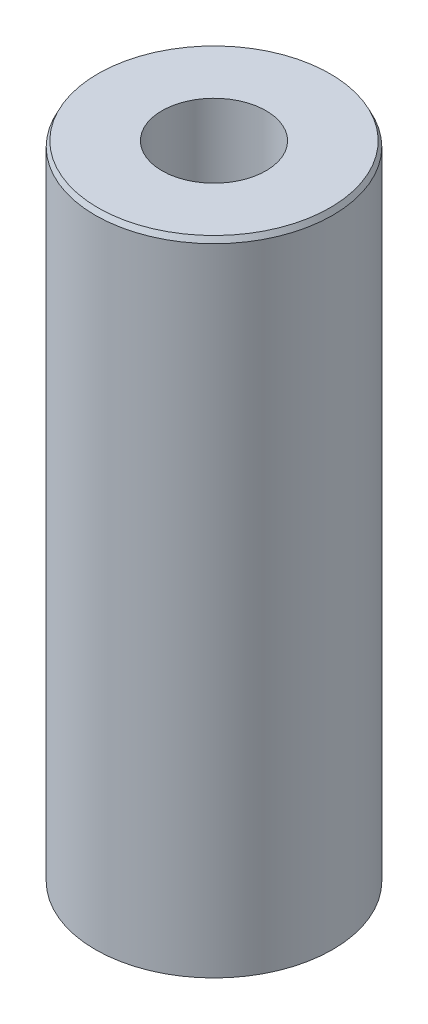
from build123d import *
from OCP.BRepFilletAPI import BRepFilletAPI_MakeChamfer

# Parameters (mm, degrees)
SKETCH1_R           = 52.5
BOSS_EXTRUDE1_DEPTH = 284.811464583
SKETCH2_R           = 23.032780733
CUT_EXTRUDE1_DEPTH  = 295.329866575
CHAMFER1_SIZE       = 2.333936894
CHAMFER1_SIZE2      = 1.131664588


with BuildPart() as part:
    # Sketch1 → Boss-Extrude1 (new body)
    with BuildSketch(Plane(origin=(0, 0, 0), x_dir=(1, 0, 0), z_dir=(0, 1, 0))):
        Circle(SKETCH1_R)
    extrude(amount=BOSS_EXTRUDE1_DEPTH)

    # Sketch2 → Cut-Extrude1 (cut, through all)
    with BuildSketch(Plane(origin=(0, 0, 0), x_dir=(1, 0, 0), z_dir=(0, 1, 0))):
        Circle(SKETCH2_R)
    extrude(amount=CUT_EXTRUDE1_DEPTH, mode=Mode.SUBTRACT)

    # Chamfer1: one chamfer whose edges measure the first distance from different faces: ONE call of the kernel's chamfer builder (chamfer() names one face for all edges)
    chamfer1_edges_1 = [part.edges().sort_by_distance(p)[0] for p in [
        (-52.5, 284.811464583, 0),
    ]]
    chamfer1_side_1 = [part.faces().sort_by_distance(p)[0] for p in [
        (-52.5, 142.405732292, 0),
    ]]
    chamfer1_edges_2 = [part.edges().sort_by_distance(p)[0] for p in [
        (-52.5, 0, 0),
    ]]
    chamfer1_side_2 = [part.faces().sort_by_distance(p)[0] for p in [
        (-51.01507576, 0, 0),
    ]]
    chamfer1 = BRepFilletAPI_MakeChamfer(part.part.solid().wrapped)
    for e in chamfer1_edges_1:
        chamfer1.Add(CHAMFER1_SIZE, CHAMFER1_SIZE2, e.wrapped, chamfer1_side_1[0].wrapped)  # the first distance lies on this face
    for e in chamfer1_edges_2:
        chamfer1.Add(CHAMFER1_SIZE, CHAMFER1_SIZE2, e.wrapped, chamfer1_side_2[0].wrapped)  # the first distance lies on this face
    add(Compound.cast(chamfer1.Shape()), mode=Mode.REPLACE)


solid = part.part
